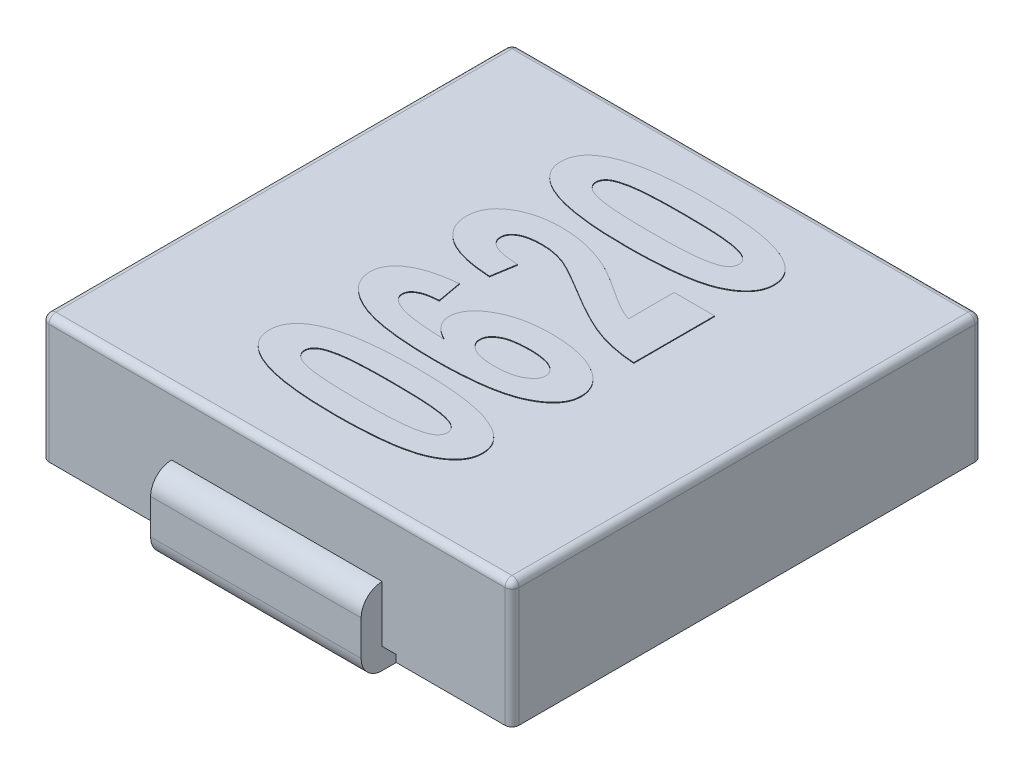
from build123d import *

# Parameters (mm, degrees)
EXTRUDE_1_DEPTH     = 1.8
SKETCH_2_W          = 3.4
SKETCH_2_H          = 2
CUT_EXTRUDE_1_DEPTH = 0.1
EXTRUDE_START       = -1.5
EXTRUDE_1_2_DEPTH   = 3
EXTRUDE_2_DEPTH     = 3
FILLET_1_R          = 0.1
EXTRUDE_2_2_DEPTH   = 0.01


# Read off the part's stored shape, not the designer's step: Вытянуть-Тонкостенный1, Вытянуть-Тонкостенный2
with BuildPart() as part:
    # Эскиз1 → Extrude 1 (new body)
    with BuildSketch(Plane(origin=(0, 0, 0), x_dir=(1, 0, 0), z_dir=(0, 1, 0))):
        with BuildLine():
            Line((-3.25, -3.35), (3.25, -3.35))
            ThreePointArc((3.25, -3.35), (3.320710678, -3.320710678), (3.35, -3.25))
            Line((3.35, -3.25), (3.35, 3.25))
            ThreePointArc((3.35, 3.25), (3.320710678, 3.320710678), (3.25, 3.35))
            Line((3.25, 3.35), (-3.25, 3.35))
            ThreePointArc((-3.25, 3.35), (-3.320710678, 3.320710678), (-3.35, 3.25))
            Line((-3.35, 3.25), (-3.35, -3.25))
            ThreePointArc((-3.35, -3.25), (-3.320710678, -3.320710678), (-3.25, -3.35))
        make_face()
    extrude(amount=EXTRUDE_1_DEPTH)

    # Эскиз2 → Вырез-Вытянуть1 (cut)
    with BuildSketch(Plane.XZ):
        with Locations((0, 2.35)):
            Rectangle(SKETCH_2_W, SKETCH_2_H)
        with Locations((0, -2.35)):
            Rectangle(SKETCH_2_W, SKETCH_2_H)
    extrude(amount=-CUT_EXTRUDE_1_DEPTH, mode=Mode.SUBTRACT)

    # Extrude 1 2 outline → Extrude 1 2 (add)
    with BuildSketch(Plane(origin=(0, 0, 0), x_dir=(0, 0, -1), z_dir=(1, 0, 0)).offset(EXTRUDE_START)):
        with BuildLine():
            Line((-3.35, -0.2), (-1.85, -0.2))
            Line((-1.85, -0.2), (-1.85, 0.1))
            Line((-1.85, 0.1), (-3.35, 0.1))
            Line((-3.35, 0.1), (-3.35, 0.9))
            ThreePointArc((-3.35, 0.9), (-3.562132034, 0.812132034), (-3.65, 0.6))
            Line((-3.65, 0.6), (-3.65, 0.1))
            ThreePointArc((-3.65, 0.1), (-3.562132034, -0.112132034), (-3.35, -0.2))
        make_face()
    extrude(amount=EXTRUDE_1_2_DEPTH)

    # Extrude 2 outline → Extrude 2 (add)
    with BuildSketch(Plane(origin=(0, 0, 0), x_dir=(0, 0, -1), z_dir=(1, 0, 0)).offset(EXTRUDE_START)):
        with BuildLine():
            Line((1.85, 0.1), (1.85, -0.2))
            Line((1.85, -0.2), (3.35, -0.2))
            ThreePointArc((3.35, -0.2), (3.562132034, -0.112132034), (3.65, 0.1))
            Line((3.65, 0.1), (3.65, 0.6))
            ThreePointArc((3.65, 0.6), (3.562132034, 0.812132034), (3.35, 0.9))
            Line((3.35, 0.9), (3.35, 0.1))
            Line((3.35, 0.1), (1.85, 0.1))
        make_face()
    extrude(amount=EXTRUDE_2_DEPTH)

    # Скругление1
    fillet_1_edges = [part.edges().sort_by_distance(p)[0] for p in [
        (3.320710678, 1.8, 3.320710678),
        (3.35, 1.8, 0),
        (3.320710678, 1.8, -3.320710678),
        (0, 1.8, -3.35),
        (-3.320710678, 1.8, -3.320710678),
        (-3.35, 1.8, 0),
        (-3.320710678, 1.8, 3.320710678),
        (0, 1.8, 3.35),
    ]]
    fillet(fillet_1_edges, radius=FILLET_1_R)

    # Эскиз4 → Extrude 2 2 (add)
    # profile 1 of 4: a face of its own
    with BuildSketch(Plane(origin=(0, 1.8, 0), x_dir=(1, 0, 0), z_dir=(0, 1, 0))):
        with BuildLine():
            add(Edge.make_bspline(
                [(-1.5, -1.957692308), (-1.499137143, -1.936566876), (-1.497447551, -1.895200382), (-1.482242122, -1.835098379), (-1.458087806, -1.778584119), (-1.423755807, -1.725761979), (-1.379856182, -1.676448664), (-1.325522016, -1.631842814), (-1.26298141, -1.589080556), (-1.216074382, -1.565892222), (-1.191706731, -1.553846154)],
                knots=[0, 0, 0, 0, 0.939629869, 1.83992419, 2.743264454, 3.666481804, 4.633505536, 5.672028627, 6.790646185, 8, 8, 8, 8], degree=3))
            add(Edge.make_bspline(
                [(-1.191706731, -1.553846154), (-1.158904384, -1.53955104), (-1.089763949, -1.509419953), (-0.974752135, -1.475847916), (-0.845845006, -1.445625948), (-0.701374134, -1.422391671), (-0.542246126, -1.402919805), (-0.367938846, -1.39061196), (-0.178780437, -1.381621929), (-0.047688732, -1.381060813), (0.020432692, -1.380769231)],
                knots=[0, 0, 0, 0, 0.695993191, 1.467006985, 2.327867947, 3.272915826, 4.313905632, 5.448135814, 6.673931191, 8, 8, 8, 8], degree=3))
            add(Edge.make_bspline(
                [(0.020432692, -1.380769231), (0.088346822, -1.38142732), (0.219213706, -1.382695421), (0.408266166, -1.390058637), (0.582217851, -1.404033081), (0.741553906, -1.421993189), (0.886013143, -1.446535154), (1.015745714, -1.476191084), (1.131109184, -1.510782717), (1.200752724, -1.540810484), (1.233774038, -1.555048077)],
                knots=[0, 0, 0, 0, 1.320779415, 2.545071084, 3.678366063, 4.713891943, 5.66240021, 6.526117529, 7.301162213, 8, 8, 8, 8], degree=3))
            add(Edge.make_bspline(
                [(1.233774038, -1.555048077), (1.257897503, -1.567159433), (1.304232457, -1.590422224), (1.366586207, -1.632149894), (1.419375705, -1.677271606), (1.462958308, -1.725975571), (1.497291664, -1.778447599), (1.520545201, -1.835248332), (1.53595582, -1.895181056), (1.537614479, -1.936560343), (1.538461538, -1.957692308)],
                knots=[0, 0, 0, 0, 1.209008214, 2.322193053, 3.353572777, 4.313995313, 5.243012364, 6.148517307, 7.054467326, 8, 8, 8, 8], degree=3))
            add(Edge.make_bspline(
                [(1.538461538, -1.957692308), (1.537411817, -1.978827802), (1.535332896, -2.02068559), (1.518925325, -2.081659932), (1.492824036, -2.139688165), (1.455493603, -2.194066787), (1.407742305, -2.245076498), (1.349426407, -2.292430364), (1.280976264, -2.336770497), (1.20193948, -2.378856542), (1.109155229, -2.416617895), (1.000326036, -2.447366483), (0.875989924, -2.475078094), (0.73501802, -2.496736352), (0.57803189, -2.514064356), (0.404573204, -2.525324635), (0.215024127, -2.533630888), (0.083143563, -2.534278123), (0.014423077, -2.534615385)],
                knots=[0, 0, 0, 0, 0.570946305, 1.130730606, 1.695682016, 2.284720325, 2.905752519, 3.57931678, 4.311109974, 5.108472247, 5.997836566, 7.014420583, 8.163245194, 9.441390503, 10.869501499, 12.433562194, 14.141596213, 16, 16, 16, 16], degree=3))
            add(Edge.make_bspline(
                [(0.014423077, -2.534615385), (-0.053091481, -2.533963284), (-0.183359594, -2.532705068), (-0.371596935, -2.525242226), (-0.545219308, -2.51161966), (-0.703981404, -2.492416926), (-0.848231491, -2.469095664), (-0.97745489, -2.439051032), (-1.092651154, -2.404620183), (-1.162292314, -2.374580012), (-1.1953125, -2.360336538)],
                knots=[0, 0, 0, 0, 1.316839064, 2.540817049, 3.673540427, 4.712565747, 5.659351526, 6.521795573, 7.299112968, 8, 8, 8, 8], degree=3))
            add(Edge.make_bspline(
                [(-1.1953125, -2.360336538), (-1.219440057, -2.348228581), (-1.265782873, -2.324972317), (-1.32808256, -2.283199756), (-1.381170251, -2.238132726), (-1.424095116, -2.188901849), (-1.459027623, -2.136872971), (-1.482048346, -2.080111905), (-1.497503564, -2.020209967), (-1.499156079, -1.978826439), (-1.5, -1.957692308)],
                knots=[0, 0, 0, 0, 1.209129629, 2.322426261, 3.353909562, 4.321163245, 5.242735491, 6.14833137, 7.05437237, 8, 8, 8, 8], degree=3))
        make_face()
        with BuildLine():
            add(Edge.make_bspline(
                [(-1, -1.957692308), (-0.999127679, -1.968216797), (-0.997360051, -1.989543107), (-0.98464763, -2.020189646), (-0.963752812, -2.048548502), (-0.934793713, -2.075564705), (-0.894910908, -2.09990752), (-0.842840464, -2.120448699), (-0.778433667, -2.137921563), (-0.731044768, -2.146944568), (-0.705528846, -2.151802885)],
                knots=[0, 0, 0, 0, 0.66053735, 1.338480494, 2.051183008, 2.861689582, 3.811811342, 4.969049189, 6.368024884, 8, 8, 8, 8], degree=3))
            add(Edge.make_bspline(
                [(-0.705528846, -2.151802885), (-0.686111734, -2.154704884), (-0.644159002, -2.160974962), (-0.576454743, -2.168853117), (-0.499229717, -2.1742951), (-0.413125803, -2.180127901), (-0.317716076, -2.183163637), (-0.213360006, -2.186421571), (-0.099564736, -2.188131724), (-0.020633397, -2.188348668), (0.020432692, -2.188461538)],
                knots=[0, 0, 0, 0, 0.647628605, 1.399270384, 2.247685976, 3.201110699, 4.24594481, 5.39623077, 6.6453211, 8, 8, 8, 8], degree=3))
            add(Edge.make_bspline(
                [(0.020432692, -2.188461538), (0.061297689, -2.188275136), (0.13962396, -2.187917856), (0.252024839, -2.187185067), (0.354384455, -2.183885271), (0.446927652, -2.18023517), (0.529543314, -2.176665945), (0.602017058, -2.17022466), (0.664624604, -2.164110466), (0.732465088, -2.153898049), (0.803572683, -2.140125262), (0.875380999, -2.120604957), (0.93178471, -2.099804879), (0.973513657, -2.07550215), (1.002243275, -2.048087616), (1.023951014, -2.020532594), (1.035633028, -1.989383166), (1.037524767, -1.968187963), (1.038461538, -1.957692308)],
                knots=[0, 0, 0, 0, 1.772229522, 3.396846643, 4.874325468, 6.213183949, 7.413572011, 8.459660885, 9.368179202, 10.14095794, 11.434081607, 12.506883432, 13.365124891, 14.035567992, 14.582591736, 15.079517174, 15.544185971, 16, 16, 16, 16], degree=3))
            add(Edge.make_bspline(
                [(1.038461538, -1.957692308), (1.037650183, -1.946944638), (1.036035603, -1.925557014), (1.022740293, -1.895014588), (1.002646122, -1.866265058), (0.972969063, -1.83991199), (0.933432472, -1.815419158), (0.881280735, -1.794956445), (0.816902053, -1.777456443), (0.769508703, -1.768437735), (0.743990385, -1.763581731)],
                knots=[0, 0, 0, 0, 0.672803919, 1.338864841, 2.061605897, 2.863308736, 3.813131099, 4.970004284, 6.368539142, 8, 8, 8, 8], degree=3))
            add(Edge.make_bspline(
                [(0.743990385, -1.763581731), (0.724572687, -1.760684675), (0.682815507, -1.754454644), (0.615519911, -1.746519364), (0.538893118, -1.741091016), (0.453191294, -1.735236285), (0.357980214, -1.732225337), (0.253624515, -1.728961702), (0.140029441, -1.727256369), (0.061298449, -1.727036962), (0.020432692, -1.726923077)],
                knots=[0, 0, 0, 0, 0.649769229, 1.397309303, 2.24191953, 3.191878681, 4.240166309, 5.394254338, 6.647473319, 8, 8, 8, 8], degree=3))
            add(Edge.make_bspline(
                [(0.020432692, -1.726923077), (-0.020432322, -1.727108707), (-0.098758626, -1.727464505), (-0.211359517, -1.728208719), (-0.313919908, -1.731488821), (-0.40666384, -1.735142837), (-0.489476366, -1.73875147), (-0.562156311, -1.745124382), (-0.62496015, -1.751282622), (-0.692610398, -1.761433922), (-0.763505543, -1.775316331), (-0.835258867, -1.79490132), (-0.892136546, -1.815562221), (-0.934274946, -1.839978234), (-0.963909922, -1.866874521), (-0.98462943, -1.895212168), (-0.997364372, -1.925837425), (-0.999129107, -1.947166469), (-1, -1.957692308)],
                knots=[0, 0, 0, 0, 1.769047239, 3.390747135, 4.874240912, 6.210695287, 7.408927887, 8.461780351, 9.368667298, 10.140058405, 11.422355672, 12.493231132, 13.358012728, 14.034682899, 14.587091034, 15.078019327, 15.545004449, 16, 16, 16, 16], degree=3))
        make_face(mode=Mode.SUBTRACT)
    # profile 2 of 4: a face of its own
    with BuildSketch(Plane(origin=(0, 1.8, 0), x_dir=(1, 0, 0), z_dir=(0, 1, 0))):
        with BuildLine():
            Line((-0.716947115, -0.034615385), (-0.653846154, -0.380769231))
            add(Edge.make_bspline(
                [(-0.653846154, -0.380769231), (-0.681547205, -0.382889175), (-0.733200789, -0.386842193), (-0.804831062, -0.399473341), (-0.865288637, -0.416090973), (-0.914169487, -0.438291327), (-0.952438737, -0.464341137), (-0.979725566, -0.494738618), (-0.996995203, -0.529605986), (-0.99898864, -0.554458508), (-1, -0.567067308)],
                knots=[0, 0, 0, 0, 1.549919711, 2.8901037, 4.054353795, 5.039938989, 5.874463713, 6.61920834, 7.299462416, 8, 8, 8, 8], degree=3))
            add(Edge.make_bspline(
                [(-1, -0.567067308), (-0.999654476, -0.575566657), (-0.99896188, -0.592603468), (-0.98950017, -0.617077399), (-0.976354433, -0.640877904), (-0.957197105, -0.663312067), (-0.932677568, -0.684107646), (-0.903627614, -0.704983619), (-0.868638664, -0.723635404), (-0.827958571, -0.742415177), (-0.778668125, -0.759259885), (-0.719275561, -0.774771817), (-0.648460203, -0.787425798), (-0.566873386, -0.799268821), (-0.474338721, -0.810310047), (-0.370650905, -0.818109574), (-0.255880051, -0.825624574), (-0.17549124, -0.828686016), (-0.133413462, -0.830288462)],
                knots=[0, 0, 0, 0, 0.421598826, 0.845088239, 1.292540369, 1.774895999, 2.30602329, 2.893820393, 3.555766604, 4.280231038, 5.127209864, 6.150050241, 7.339703188, 8.713347625, 10.262722907, 11.9871774, 13.89957508, 16, 16, 16, 16], degree=3))
            add(Edge.make_bspline(
                [(-0.133413462, -0.830288462), (-0.153226041, -0.819580375), (-0.19108179, -0.799120512), (-0.242718247, -0.764788806), (-0.286608857, -0.728348218), (-0.321502927, -0.688749083), (-0.350077859, -0.648240126), (-0.370205963, -0.605180581), (-0.381933675, -0.559868017), (-0.383717932, -0.529071749), (-0.384615385, -0.513581731)],
                knots=[0, 0, 0, 0, 1.267157945, 2.421149296, 3.485202224, 4.467489562, 5.383884497, 6.266713326, 7.128185226, 8, 8, 8, 8], degree=3))
            add(Edge.make_bspline(
                [(-0.384615385, -0.513581731), (-0.383753764, -0.496092925), (-0.382039735, -0.461302267), (-0.369774534, -0.40992183), (-0.348123112, -0.360966415), (-0.319073969, -0.313802855), (-0.28172485, -0.268656146), (-0.23557482, -0.226326612), (-0.181677232, -0.185291033), (-0.12020114, -0.146556207), (-0.052015436, -0.111758018), (0.020926011, -0.079830438), (0.099461039, -0.054651517), (0.182180379, -0.032638342), (0.270071765, -0.016824283), (0.362307799, -0.004782102), (0.459617513, 0.002554479), (0.526028935, 0.003408212), (0.560096154, 0.003846154)],
                knots=[0, 0, 0, 0, 0.712118958, 1.416625472, 2.136553801, 2.883795801, 3.66624321, 4.51480892, 5.428643096, 6.422356621, 7.469656695, 8.544188354, 9.661363121, 10.824973369, 12.028350145, 13.295373735, 14.612601657, 16, 16, 16, 16], degree=3))
            add(Edge.make_bspline(
                [(0.560096154, 0.003846154), (0.596168309, 0.003421893), (0.666384952, 0.002596043), (0.769063955, -0.004896221), (0.866298056, -0.016328939), (0.957852718, -0.034227442), (1.044263907, -0.05525344), (1.124753742, -0.082731392), (1.200519276, -0.113530758), (1.26974538, -0.150376182), (1.332843965, -0.189815334), (1.38725083, -0.23361695), (1.434194106, -0.279210116), (1.472474655, -0.328003059), (1.501748007, -0.38000015), (1.523067826, -0.434539702), (1.53609788, -0.492139584), (1.537668448, -0.531544161), (1.538461538, -0.551442308)],
                knots=[0, 0, 0, 0, 1.39498986, 2.71543254, 3.980142828, 5.179086445, 6.321625476, 7.416841902, 8.465806243, 9.481271331, 10.446328925, 11.339337795, 12.177594524, 12.972664813, 13.729001214, 14.477197864, 15.231029898, 16, 16, 16, 16], degree=3))
            add(Edge.make_bspline(
                [(1.538461538, -0.551442308), (1.537427146, -0.572777842), (1.535366803, -0.615274755), (1.518481686, -0.677481166), (1.490480293, -0.736422249), (1.45069746, -0.791763062), (1.401339194, -0.844850442), (1.340291423, -0.894127013), (1.268586086, -0.940394461), (1.186011794, -0.984335233), (1.090810257, -1.024609906), (0.981459802, -1.05696177), (0.859116341, -1.087065691), (0.722201649, -1.109467722), (0.571499521, -1.128453191), (0.406581412, -1.139980044), (0.228067882, -1.149182415), (0.104381233, -1.149720874), (0.040264423, -1.15)],
                knots=[0, 0, 0, 0, 0.582864578, 1.16097142, 1.749167969, 2.358718482, 3.017750106, 3.726302687, 4.498298734, 5.348834351, 6.281956375, 7.320036994, 8.464218828, 9.726176242, 11.111856478, 12.61750766, 14.246580185, 16, 16, 16, 16], degree=3))
            add(Edge.make_bspline(
                [(0.040264423, -1.15), (-0.025447276, -1.149345796), (-0.152311215, -1.148082781), (-0.335546367, -1.140643622), (-0.504560877, -1.126987543), (-0.659125219, -1.10779629), (-0.799750296, -1.084409689), (-0.926046606, -1.054514414), (-1.038405685, -1.019590677), (-1.136586221, -0.978467516), (-1.221972319, -0.933227902), (-1.296065858, -0.884767436), (-1.358167243, -0.832084508), (-1.410522361, -0.777569442), (-1.450234722, -0.718215697), (-1.478642787, -0.655712732), (-1.497291946, -0.589966759), (-1.49909323, -0.544754917), (-1.5, -0.521995192)],
                knots=[0, 0, 0, 0, 1.739098909, 3.357529062, 4.85223663, 6.225247106, 7.478570524, 8.623010299, 9.657512328, 10.588950926, 11.435634555, 12.211994303, 12.92677536, 13.586936376, 14.20596628, 14.806185805, 15.399031722, 16, 16, 16, 16], degree=3))
            add(Edge.make_bspline(
                [(-1.5, -0.521995192), (-1.499509835, -0.505912065), (-1.498544734, -0.474245452), (-1.48823713, -0.428027115), (-1.472908661, -0.383689243), (-1.45008245, -0.342235737), (-1.422204146, -0.30221565), (-1.386808754, -0.265294978), (-1.345917612, -0.229675703), (-1.298656162, -0.196710911), (-1.245690419, -0.165926024), (-1.186493628, -0.138726176), (-1.122305644, -0.113139062), (-1.051964992, -0.091975207), (-0.976507625, -0.072427191), (-0.894885635, -0.057345975), (-0.807953117, -0.043816558), (-0.74783237, -0.037738042), (-0.716947115, -0.034615385)],
                knots=[0, 0, 0, 0, 0.76381956, 1.50391014, 2.242342492, 2.988420858, 3.747230929, 4.55625529, 5.414143539, 6.323616016, 7.292829522, 8.324445395, 9.419800476, 10.577190305, 11.815979938, 13.12605627, 14.523596504, 16, 16, 16, 16], degree=3))
        make_face()
        with BuildLine():
            add(Edge.make_bspline(
                [(0.546875, -0.803846154), (0.583979099, -0.802982954), (0.653869542, -0.801357004), (0.752205069, -0.787904535), (0.837302066, -0.764872177), (0.908736182, -0.732952461), (0.964873214, -0.693863458), (1.006703356, -0.652463235), (1.033893336, -0.606715693), (1.036965076, -0.573993964), (1.038461538, -0.558052885)],
                knots=[0, 0, 0, 0, 1.487550157, 2.801996091, 3.96948146, 5.011955507, 5.923443518, 6.696061968, 7.364759143, 8, 8, 8, 8], degree=3))
            add(Edge.make_bspline(
                [(1.038461538, -0.558052885), (1.037247589, -0.542975729), (1.034821752, -0.512847031), (1.01275913, -0.470990618), (0.979139196, -0.433336895), (0.940843155, -0.407605158), (0.904366542, -0.388787238), (0.871658869, -0.37638195), (0.834963082, -0.36540953), (0.793808605, -0.357538593), (0.748802939, -0.349978418), (0.699405743, -0.345359083), (0.645851915, -0.343266067), (0.608775561, -0.342635026), (0.589543269, -0.342307692)],
                knots=[0, 0, 0, 0, 0.98415851, 1.96664515, 3.038345339, 4.2755351, 4.969759699, 5.731949388, 6.568604871, 7.481899529, 8.481065577, 9.564888458, 10.736856013, 12, 12, 12, 12], degree=3))
            add(Edge.make_bspline(
                [(0.589543269, -0.342307692), (0.569708839, -0.342582964), (0.531418978, -0.343114368), (0.476051528, -0.345911797), (0.424928736, -0.351378852), (0.377810294, -0.358615233), (0.33470023, -0.367193062), (0.295721336, -0.378754893), (0.260906126, -0.392429778), (0.221493613, -0.412585751), (0.180059321, -0.440438597), (0.143547098, -0.480900385), (0.119316595, -0.526029455), (0.11669742, -0.558569706), (0.115384615, -0.574879808)],
                knots=[0, 0, 0, 0, 1.22920971, 2.372957979, 3.434023047, 4.413685549, 5.326664308, 6.15541423, 6.929955182, 7.640580054, 8.897558011, 9.996505919, 10.995791649, 12, 12, 12, 12], degree=3))
            add(Edge.make_bspline(
                [(0.115384615, -0.574879808), (0.116603075, -0.590534425), (0.119054708, -0.622032703), (0.141364485, -0.666457866), (0.177501245, -0.705244394), (0.225416305, -0.741153975), (0.287618906, -0.769565278), (0.36277845, -0.789326477), (0.45050488, -0.801900588), (0.513373049, -0.803169801), (0.546875, -0.803846154)],
                knots=[0, 0, 0, 0, 0.695405127, 1.39920786, 2.165432477, 3.046964329, 4.054821068, 5.195738149, 6.505630974, 8, 8, 8, 8], degree=3))
        make_face(mode=Mode.SUBTRACT)
    # profile 3 of 4: a face of its own
    with BuildSketch(Plane(origin=(0, 1.8, 0), x_dir=(1, 0, 0), z_dir=(0, 1, 0))):
        with BuildLine():
            Line((0.923076923, 1.388461538), (1.5, 1.388461538))
            Line((1.5, 1.388461538), (1.5, 0.234615385))
            add(Edge.make_bspline(
                [(1.5, 0.234615385), (1.450853252, 0.238584068), (1.353373651, 0.24645571), (1.209518342, 0.269385657), (1.069824563, 0.302382751), (0.954775219, 0.336137462), (0.861831581, 0.370848815), (0.786577951, 0.402134359), (0.706311018, 0.439469424), (0.620644325, 0.482728027), (0.528862356, 0.530238691), (0.432243633, 0.584796257), (0.329998682, 0.644178513), (0.260542889, 0.686413714), (0.224759615, 0.708173077)],
                knots=[0, 0, 0, 0, 1.289104735, 2.556861274, 3.804708595, 5.041066993, 5.689154205, 6.398382692, 7.171855468, 8.003542895, 8.908005236, 9.874257051, 10.90482796, 12, 12, 12, 12], degree=3))
            add(Edge.make_bspline(
                [(0.224759615, 0.708173077), (0.196100865, 0.725378657), (0.141404786, 0.758216019), (0.063286072, 0.805580741), (-0.008057021, 0.846667285), (-0.071927573, 0.883149313), (-0.128850398, 0.913791061), (-0.178890604, 0.93892627), (-0.221288367, 0.959811216), (-0.247743986, 0.97071025), (-0.259615385, 0.975600962)],
                knots=[0, 0, 0, 0, 1.448700748, 2.764888605, 3.959120297, 5.01657917, 5.952674831, 6.760260168, 7.443692973, 8, 8, 8, 8], degree=3))
            add(Edge.make_bspline(
                [(-0.259615385, 0.975600962), (-0.288681493, 0.986021872), (-0.345673023, 1.00645473), (-0.43321846, 1.026390473), (-0.519810482, 1.039883117), (-0.577674092, 1.041503902), (-0.606370192, 1.042307692)],
                knots=[0, 0, 0, 0, 1.042928232, 2.044927184, 3.030427494, 4, 4, 4, 4], degree=3))
            add(Edge.make_bspline(
                [(-0.606370192, 1.042307692), (-0.636254845, 1.041677886), (-0.692414055, 1.040494355), (-0.771350698, 1.030240021), (-0.839754634, 1.014277681), (-0.897016986, 0.990451322), (-0.942438747, 0.96045399), (-0.976422156, 0.92487946), (-0.996082239, 0.881993633), (-0.998682302, 0.85158753), (-1, 0.836177885)],
                knots=[0, 0, 0, 0, 1.458031234, 2.739930902, 3.878203939, 4.877043568, 5.750258799, 6.518463336, 7.249165373, 8, 8, 8, 8], degree=3))
            add(Edge.make_bspline(
                [(-1, 0.836177885), (-0.998749858, 0.820936016), (-0.996253168, 0.79049611), (-0.974877469, 0.747706846), (-0.939320842, 0.711970016), (-0.901140248, 0.686841633), (-0.863713778, 0.669995558), (-0.830181417, 0.658021335), (-0.792095297, 0.648119949), (-0.75004508, 0.63893251), (-0.703434064, 0.632028553), (-0.65255721, 0.625884646), (-0.596997571, 0.621888532), (-0.558497777, 0.620140492), (-0.538461538, 0.619230769)],
                knots=[0, 0, 0, 0, 0.977985299, 1.953158208, 3.002652506, 4.194234773, 4.875468122, 5.642662911, 6.484547082, 7.408173722, 8.41360214, 9.517816347, 10.70821063, 12, 12, 12, 12], degree=3))
            Line((-0.538461538, 0.619230769), (-0.594951923, 0.273076923))
            add(Edge.make_bspline(
                [(-0.594951923, 0.273076923), (-0.633844836, 0.275955802), (-0.708969474, 0.281516576), (-0.817231505, 0.294853732), (-0.917046334, 0.311197909), (-1.008384911, 0.332265098), (-1.091185148, 0.357199547), (-1.16556596, 0.386062877), (-1.231734225, 0.418220996), (-1.289081189, 0.455163597), (-1.338992237, 0.495126664), (-1.381615407, 0.537901363), (-1.418282253, 0.582554002), (-1.447987042, 0.630066472), (-1.471714803, 0.679751055), (-1.487782607, 0.732447668), (-1.498631252, 0.787051923), (-1.499541219, 0.824506037), (-1.5, 0.843389423)],
                knots=[0, 0, 0, 0, 1.579560095, 3.051041266, 4.417077792, 5.674853277, 6.845369828, 7.916761964, 8.903834858, 9.819948492, 10.674094803, 11.488866127, 12.261919774, 13.009380386, 13.753530217, 14.484962415, 15.236157608, 16, 16, 16, 16], degree=3))
            add(Edge.make_bspline(
                [(-1.5, 0.843389423), (-1.499307756, 0.864062862), (-1.497946987, 0.904701367), (-1.487232218, 0.963912062), (-1.46799251, 1.019210304), (-1.442749146, 1.071646754), (-1.409529841, 1.120435872), (-1.368448314, 1.165218455), (-1.320795913, 1.20692188), (-1.265929318, 1.24424351), (-1.206170002, 1.278481138), (-1.141889113, 1.307759421), (-1.07398878, 1.33217558), (-1.003203375, 1.353764665), (-0.928265735, 1.36883928), (-0.850065212, 1.380477026), (-0.768138086, 1.386967668), (-0.712350252, 1.387956937), (-0.683894231, 1.388461538)],
                knots=[0, 0, 0, 0, 0.907189765, 1.783294833, 2.628589816, 3.470126486, 4.331009267, 5.208745366, 6.131021837, 7.104202236, 8.116286935, 9.151072103, 10.199772534, 11.28199686, 12.396008899, 13.551211837, 14.750932554, 16, 16, 16, 16], degree=3))
            add(Edge.make_bspline(
                [(-0.683894231, 1.388461538), (-0.65122476, 1.388065403), (-0.586590807, 1.387281679), (-0.490916785, 1.379053703), (-0.397622497, 1.36658273), (-0.305918667, 1.348973116), (-0.214411693, 1.325942809), (-0.121632449, 1.296767791), (-0.026653447, 1.262138403), (0.036392762, 1.234746956), (0.068509615, 1.220793269)],
                knots=[0, 0, 0, 0, 1.008927202, 1.996082299, 2.963965572, 3.915410391, 4.87891233, 5.8770608, 6.918537254, 8, 8, 8, 8], degree=3))
            add(Edge.make_bspline(
                [(0.068509615, 1.220793269), (0.079953856, 1.215439544), (0.104219495, 1.204087848), (0.142221579, 1.184872481), (0.183287061, 1.161690056), (0.228941295, 1.136846409), (0.276968434, 1.106884042), (0.32961817, 1.075548968), (0.384820808, 1.03950681), (0.442559601, 1.002324755), (0.499638775, 0.965243668), (0.552739803, 0.930507961), (0.600819697, 0.899530118), (0.644382713, 0.873484453), (0.681846079, 0.849796457), (0.714585637, 0.830498295), (0.742166312, 0.814737589), (0.784970102, 0.792322095), (0.844051566, 0.764694641), (0.897282899, 0.74564773), (0.923076923, 0.736418269)],
                knots=[0, 0, 0, 0, 0.693052831, 1.46950505, 2.335080331, 3.279634318, 4.319881199, 5.439295331, 6.640251146, 7.935623074, 9.206576243, 10.373882287, 11.416390135, 12.343591259, 13.157770686, 13.847505367, 14.428124923, 14.899986278, 16.497842864, 18, 18, 18, 18], degree=3))
            Line((0.923076923, 0.736418269), (0.923076923, 1.388461538))
        make_face()
    # profile 4 of 4: a face of its own
    with BuildSketch(Plane(origin=(0, 1.8, 0), x_dir=(1, 0, 0), z_dir=(0, 1, 0))):
        with BuildLine():
            add(Edge.make_bspline(
                [(-1.5, 2.196153846), (-1.499137143, 2.217279278), (-1.497447551, 2.258645772), (-1.482242122, 2.318747775), (-1.458087806, 2.375262035), (-1.423755807, 2.428084175), (-1.379856182, 2.47739749), (-1.325522016, 2.52200334), (-1.26298141, 2.564765598), (-1.216074382, 2.587953932), (-1.191706731, 2.6)],
                knots=[0, 0, 0, 0, 0.939629869, 1.83992419, 2.743264454, 3.666481804, 4.633505536, 5.672028627, 6.790646185, 8, 8, 8, 8], degree=3))
            add(Edge.make_bspline(
                [(-1.191706731, 2.6), (-1.158904384, 2.614295114), (-1.089763949, 2.644426201), (-0.974752135, 2.677998238), (-0.845845006, 2.708220205), (-0.701374134, 2.731454483), (-0.542246126, 2.750926349), (-0.367938846, 2.763234194), (-0.178780437, 2.772224225), (-0.047688732, 2.772785341), (0.020432692, 2.773076923)],
                knots=[0, 0, 0, 0, 0.695993191, 1.467006985, 2.327867947, 3.272915826, 4.313905632, 5.448135814, 6.673931191, 8, 8, 8, 8], degree=3))
            add(Edge.make_bspline(
                [(0.020432692, 2.773076923), (0.088346822, 2.772418834), (0.219213706, 2.771150733), (0.408266166, 2.763787517), (0.582217851, 2.749813073), (0.741553906, 2.731852965), (0.886013143, 2.707311), (1.015745714, 2.67765507), (1.131109184, 2.643063437), (1.200752724, 2.61303567), (1.233774038, 2.598798077)],
                knots=[0, 0, 0, 0, 1.320779415, 2.545071084, 3.678366063, 4.713891943, 5.66240021, 6.526117529, 7.301162213, 8, 8, 8, 8], degree=3))
            add(Edge.make_bspline(
                [(1.233774038, 2.598798077), (1.257897503, 2.586686721), (1.304232457, 2.56342393), (1.366586207, 2.52169626), (1.419375705, 2.476574548), (1.462958308, 2.427870583), (1.497291664, 2.375398555), (1.520545201, 2.318597822), (1.53595582, 2.258665098), (1.537614479, 2.217285811), (1.538461538, 2.196153846)],
                knots=[0, 0, 0, 0, 1.209008214, 2.322193053, 3.353572777, 4.313995313, 5.243012364, 6.148517307, 7.054467326, 8, 8, 8, 8], degree=3))
            add(Edge.make_bspline(
                [(1.538461538, 2.196153846), (1.537411817, 2.175018352), (1.535332896, 2.133160563), (1.518925325, 2.072186222), (1.492824036, 2.014157989), (1.455493603, 1.959779367), (1.407742305, 1.908769656), (1.349426407, 1.86141579), (1.280976264, 1.817075657), (1.20193948, 1.774989612), (1.109155229, 1.737228259), (1.000326036, 1.706479671), (0.875989924, 1.67876806), (0.73501802, 1.657109802), (0.57803189, 1.639781798), (0.404573204, 1.628521519), (0.215024127, 1.620215266), (0.083143563, 1.619568031), (0.014423077, 1.619230769)],
                knots=[0, 0, 0, 0, 0.570946305, 1.130730606, 1.695682016, 2.284720325, 2.905752519, 3.57931678, 4.311109974, 5.108472247, 5.997836566, 7.014420583, 8.163245194, 9.441390503, 10.869501499, 12.433562194, 14.141596213, 16, 16, 16, 16], degree=3))
            add(Edge.make_bspline(
                [(0.014423077, 1.619230769), (-0.053091481, 1.61988287), (-0.183359594, 1.621141086), (-0.371596935, 1.628603928), (-0.545219308, 1.642226494), (-0.703981404, 1.661429228), (-0.848231491, 1.68475049), (-0.97745489, 1.714795122), (-1.092651154, 1.749225971), (-1.162292314, 1.779266142), (-1.1953125, 1.793509615)],
                knots=[0, 0, 0, 0, 1.316839064, 2.540817049, 3.673540427, 4.712565747, 5.659351526, 6.521795573, 7.299112968, 8, 8, 8, 8], degree=3))
            add(Edge.make_bspline(
                [(-1.1953125, 1.793509615), (-1.219440057, 1.805617573), (-1.265782873, 1.828873837), (-1.32808256, 1.870646398), (-1.381170251, 1.915713428), (-1.424095116, 1.964944305), (-1.459027623, 2.016973183), (-1.482048346, 2.073734248), (-1.497503564, 2.133636187), (-1.499156079, 2.175019715), (-1.5, 2.196153846)],
                knots=[0, 0, 0, 0, 1.209129629, 2.322426261, 3.353909562, 4.321163245, 5.242735491, 6.14833137, 7.05437237, 8, 8, 8, 8], degree=3))
        make_face()
        with BuildLine():
            add(Edge.make_bspline(
                [(-1, 2.196153846), (-0.999127679, 2.185629357), (-0.997360051, 2.164303047), (-0.98464763, 2.133656508), (-0.963752812, 2.105297652), (-0.934793713, 2.078281449), (-0.894910908, 2.053938634), (-0.842840464, 2.033397455), (-0.778433667, 2.01592459), (-0.731044768, 2.006901586), (-0.705528846, 2.002043269)],
                knots=[0, 0, 0, 0, 0.66053735, 1.338480494, 2.051183008, 2.861689582, 3.811811342, 4.969049189, 6.368024884, 8, 8, 8, 8], degree=3))
            add(Edge.make_bspline(
                [(-0.705528846, 2.002043269), (-0.686111734, 1.99914127), (-0.644159002, 1.992871192), (-0.576454743, 1.984993036), (-0.499229717, 1.979551054), (-0.413125803, 1.973718253), (-0.317716076, 1.970682517), (-0.213360006, 1.967424583), (-0.099564736, 1.96571443), (-0.020633397, 1.965497486), (0.020432692, 1.965384615)],
                knots=[0, 0, 0, 0, 0.647628605, 1.399270384, 2.247685976, 3.201110699, 4.24594481, 5.39623077, 6.6453211, 8, 8, 8, 8], degree=3))
            add(Edge.make_bspline(
                [(0.020432692, 1.965384615), (0.061297689, 1.965571018), (0.13962396, 1.965928298), (0.252024839, 1.966661087), (0.354384455, 1.969960883), (0.446927652, 1.973610983), (0.529543314, 1.977180209), (0.602017058, 1.983621494), (0.664624604, 1.989735688), (0.732465088, 1.999948105), (0.803572683, 2.013720892), (0.875380999, 2.033241197), (0.93178471, 2.054041275), (0.973513657, 2.078344004), (1.002243275, 2.105758538), (1.023951014, 2.133313559), (1.035633028, 2.164462988), (1.037524767, 2.185658191), (1.038461538, 2.196153846)],
                knots=[0, 0, 0, 0, 1.772229522, 3.396846643, 4.874325468, 6.213183949, 7.413572011, 8.459660885, 9.368179202, 10.14095794, 11.434081607, 12.506883432, 13.365124891, 14.035567992, 14.582591736, 15.079517174, 15.544185971, 16, 16, 16, 16], degree=3))
            add(Edge.make_bspline(
                [(1.038461538, 2.196153846), (1.037650183, 2.206901516), (1.036035603, 2.22828914), (1.022740293, 2.258831566), (1.002646122, 2.287581096), (0.972969063, 2.313934164), (0.933432472, 2.338426996), (0.881280735, 2.358889709), (0.816902053, 2.37638971), (0.769508703, 2.385408419), (0.743990385, 2.390264423)],
                knots=[0, 0, 0, 0, 0.672803919, 1.338864841, 2.061605897, 2.863308736, 3.813131099, 4.970004284, 6.368539142, 8, 8, 8, 8], degree=3))
            add(Edge.make_bspline(
                [(0.743990385, 2.390264423), (0.724572687, 2.393161478), (0.682815507, 2.39939151), (0.615519911, 2.407326789), (0.538893118, 2.412755138), (0.453191294, 2.418609869), (0.357980214, 2.421620816), (0.253624515, 2.424884452), (0.140029441, 2.426589785), (0.061298449, 2.426809192), (0.020432692, 2.426923077)],
                knots=[0, 0, 0, 0, 0.649769229, 1.397309303, 2.24191953, 3.191878681, 4.240166309, 5.394254338, 6.647473319, 8, 8, 8, 8], degree=3))
            add(Edge.make_bspline(
                [(0.020432692, 2.426923077), (-0.020432322, 2.426737447), (-0.098758626, 2.426381649), (-0.211359517, 2.425637435), (-0.313919908, 2.422357332), (-0.40666384, 2.418703317), (-0.489476366, 2.415094684), (-0.562156311, 2.408721772), (-0.62496015, 2.402563531), (-0.692610398, 2.392412232), (-0.763505543, 2.378529823), (-0.835258867, 2.358944834), (-0.892136546, 2.338283933), (-0.934274946, 2.313867919), (-0.963909922, 2.286971633), (-0.98462943, 2.258633985), (-0.997364372, 2.228008729), (-0.999129107, 2.206679685), (-1, 2.196153846)],
                knots=[0, 0, 0, 0, 1.769047239, 3.390747135, 4.874240912, 6.210695287, 7.408927887, 8.461780351, 9.368667298, 10.140058405, 11.422355672, 12.493231132, 13.358012728, 14.034682899, 14.587091034, 15.078019327, 15.545004449, 16, 16, 16, 16], degree=3))
        make_face(mode=Mode.SUBTRACT)
    extrude(amount=EXTRUDE_2_2_DEPTH)


solid = part.part
